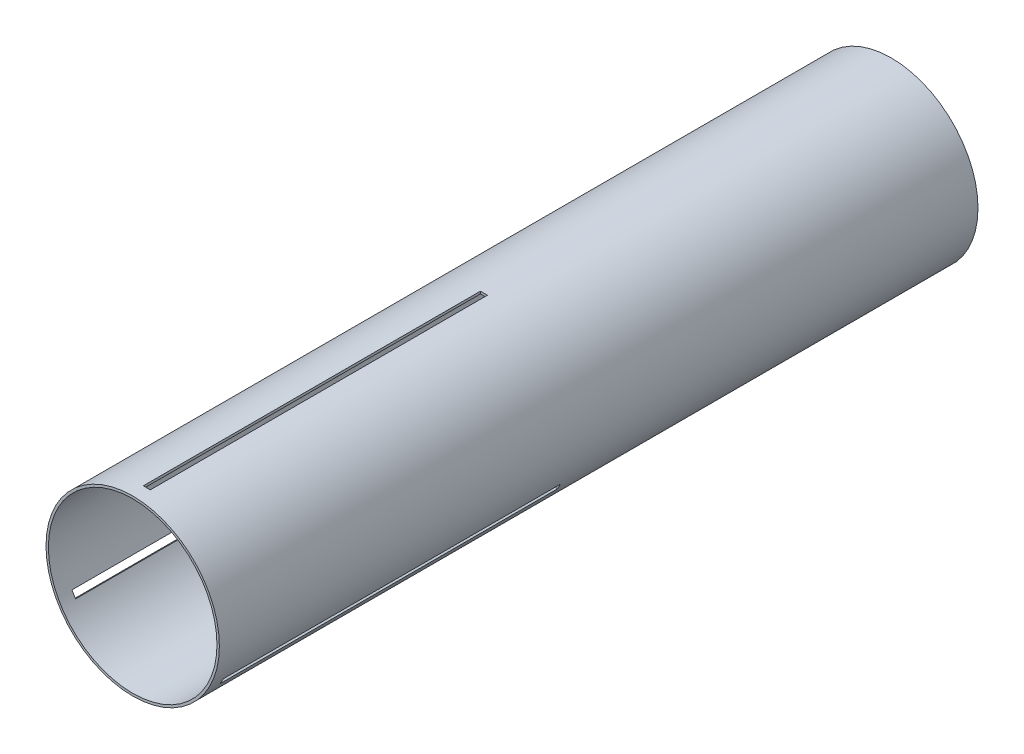
from build123d import *

# Parameters (mm, degrees)
ESQUISSE2_R                  = 78.359
ESQUISSE2_R_2                = 76.2
BOSS_EXTRU_1_DEPTH           = 685.8
ESQUISSE3_W                  = 6.35
ESQUISSE3_H                  = 304.8
ENL_V_MAT_EXTRU_1_DEPTH      = 152.4
R_P_TITION_CIRCULAIRE1_COUNT = 3


with BuildPart() as part:
    # Esquisse2 → Boss.-Extru.1 (new body)
    with BuildSketch(Plane.XY):
        Circle(ESQUISSE2_R)
        Circle(ESQUISSE2_R_2, mode=Mode.SUBTRACT)
    extrude(amount=BOSS_EXTRU_1_DEPTH)

    # Esquisse3 → Enlèv. mat.-Extru.1 (cut)
    with BuildSketch(Plane(origin=(0, 0, 0), x_dir=(1, 0, 0), z_dir=(0, 1, 0))):
        with Locations((0, -520.7)):
            Rectangle(ESQUISSE3_W, ESQUISSE3_H)
    enl_v_mat_extru_1 = extrude(amount=ENL_V_MAT_EXTRU_1_DEPTH, mode=Mode.SUBTRACT)

    # Répétition circulaire1: Enlèv. mat.-Extru.1 ×3 about axis
    r_p_tition_circulaire1_axis = Axis((0, 0, 685.8), (0, 0, -1))
    for i in range(1, R_P_TITION_CIRCULAIRE1_COUNT):
        add(enl_v_mat_extru_1.rotate(r_p_tition_circulaire1_axis, i * 360 / R_P_TITION_CIRCULAIRE1_COUNT), mode=Mode.SUBTRACT)


solid = part.part
